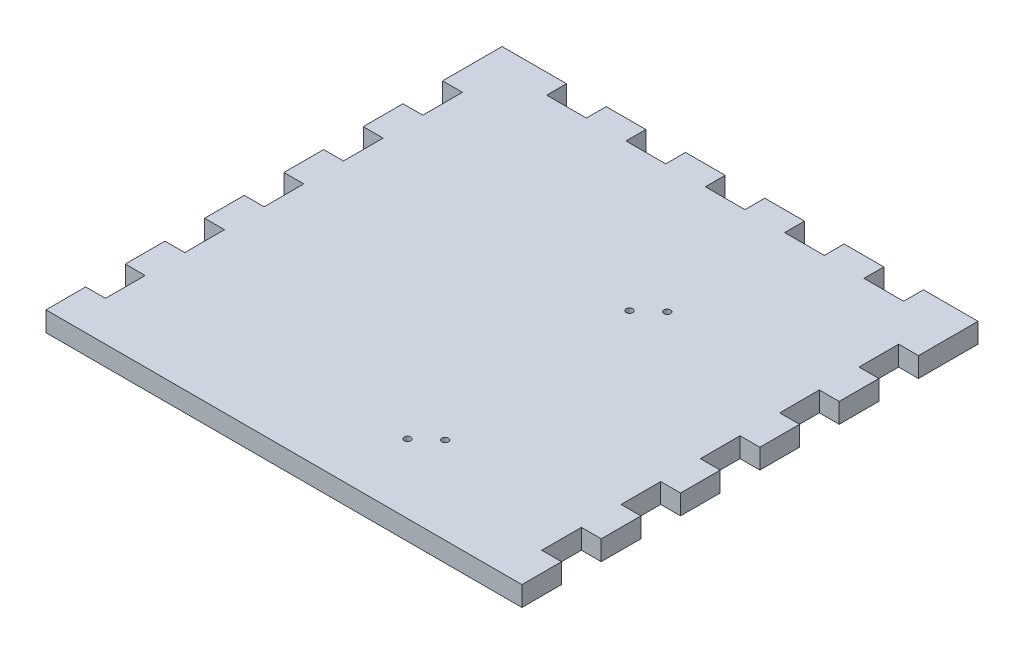
from build123d import *

# Parameters (mm, degrees)
SKETCH1_W               = 279.4
SKETCH1_H               = 279.4
BOSS_EXTRUDE1_DEPTH     = 12.7
SKETCH2_W               = 25.4
SKETCH2_H               = 12.7
BOSS_EXTRUDE2_DEPTH     = 12.7
LPATTERN1_COUNT         = 6
LPATTERN1_PITCH         = 50.8
MIRROR1_COPY_1_SKETCH_W = 25.4
MIRROR1_COPY_1_SKETCH_H = 12.7
MIRROR1_COPY_1_DEPTH    = 12.7
MIRROR1_COPY_2_SKETCH_W = 25.4
MIRROR1_COPY_2_SKETCH_H = 12.7
MIRROR1_COPY_2_DEPTH    = 12.7
MIRROR1_COPY_3_SKETCH_W = 25.4
MIRROR1_COPY_3_SKETCH_H = 12.7
MIRROR1_COPY_3_DEPTH    = 12.7
MIRROR1_COPY_4_SKETCH_W = 25.4
MIRROR1_COPY_4_SKETCH_H = 12.7
MIRROR1_COPY_4_DEPTH    = 12.7
MIRROR1_COPY_5_SKETCH_W = 25.4
MIRROR1_COPY_5_SKETCH_H = 12.7
MIRROR1_COPY_5_DEPTH    = 12.7
MIRROR1_COPY_6_SKETCH_W = 25.4
MIRROR1_COPY_6_SKETCH_H = 12.7
MIRROR1_COPY_6_DEPTH    = 12.7
SKETCH3_W               = 25.4
SKETCH3_H               = 12.7
BOSS_EXTRUDE3_DEPTH     = 12.7
LPATTERN2_COUNT         = 6
LPATTERN2_PITCH         = 50.8
SKETCH5_W               = 25.4
SKETCH5_H               = 12.7
BOSS_EXTRUDE4_DEPTH     = 12.7
SKETCH6_R               = 2.1
SKETCH6_R_2             = 2.133813769
CUT_EXTRUDE1_DEPTH      = 216.9
SKETCH7_R               = 5.08
CUT_EXTRUDE2_DEPTH      = 6.35


with BuildPart() as part:
    # Sketch1 → Boss-Extrude1 (new body)
    with BuildSketch(Plane(origin=(0, 0, 0), x_dir=(1, 0, 0), z_dir=(0, 1, 0))):
        Rectangle(SKETCH1_W, SKETCH1_H)
    extrude(amount=BOSS_EXTRUDE1_DEPTH)

    # Sketch2 → Boss-Extrude2 (add)
    with BuildSketch(Plane(origin=(139.7, 0, 0), x_dir=(0, 0, -1), z_dir=(1, 0, 0))):
        with Locations((-127, 6.35)):
            Rectangle(SKETCH2_W, SKETCH2_H)
    boss_extrude2 = extrude(amount=BOSS_EXTRUDE2_DEPTH)

    # LPattern1: Boss-Extrude2 ×6
    with Locations(*[(0, 0, -i * LPATTERN1_PITCH) for i in range(1, LPATTERN1_COUNT)]):
        add(boss_extrude2)

    # Mirror1 copy 1 sketch → Mirror1 copy 1 (add)
    with BuildSketch(Plane(origin=(-139.7, 0, -50.8), x_dir=(0, 0, -1), z_dir=(-1, 0, 0))):
        with Locations((-127, -6.35)):
            Rectangle(MIRROR1_COPY_1_SKETCH_W, MIRROR1_COPY_1_SKETCH_H)
    extrude(amount=MIRROR1_COPY_1_DEPTH)

    # Mirror1 copy 2 sketch → Mirror1 copy 2 (add)
    with BuildSketch(Plane(origin=(-139.7, 0, -101.6), x_dir=(0, 0, -1), z_dir=(-1, 0, 0))):
        with Locations((-127, -6.35)):
            Rectangle(MIRROR1_COPY_2_SKETCH_W, MIRROR1_COPY_2_SKETCH_H)
    extrude(amount=MIRROR1_COPY_2_DEPTH)

    # Mirror1 copy 3 sketch → Mirror1 copy 3 (add)
    with BuildSketch(Plane(origin=(-139.7, 0, -152.4), x_dir=(0, 0, -1), z_dir=(-1, 0, 0))):
        with Locations((-127, -6.35)):
            Rectangle(MIRROR1_COPY_3_SKETCH_W, MIRROR1_COPY_3_SKETCH_H)
    extrude(amount=MIRROR1_COPY_3_DEPTH)

    # Mirror1 copy 4 sketch → Mirror1 copy 4 (add)
    with BuildSketch(Plane(origin=(-139.7, 0, -203.2), x_dir=(0, 0, -1), z_dir=(-1, 0, 0))):
        with Locations((-127, -6.35)):
            Rectangle(MIRROR1_COPY_4_SKETCH_W, MIRROR1_COPY_4_SKETCH_H)
    extrude(amount=MIRROR1_COPY_4_DEPTH)

    # Mirror1 copy 5 sketch → Mirror1 copy 5 (add)
    with BuildSketch(Plane(origin=(-139.7, 0, -254), x_dir=(0, 0, -1), z_dir=(-1, 0, 0))):
        with Locations((-127, -6.35)):
            Rectangle(MIRROR1_COPY_5_SKETCH_W, MIRROR1_COPY_5_SKETCH_H)
    extrude(amount=MIRROR1_COPY_5_DEPTH)

    # Mirror1 copy 6 sketch → Mirror1 copy 6 (add)
    with BuildSketch(Plane(origin=(-139.7, 0, 0), x_dir=(0, 0, -1), z_dir=(-1, 0, 0))):
        with Locations((-127, -6.35)):
            Rectangle(MIRROR1_COPY_6_SKETCH_W, MIRROR1_COPY_6_SKETCH_H)
    extrude(amount=MIRROR1_COPY_6_DEPTH)

    # Sketch3 → Boss-Extrude3 (add)
    with BuildSketch(Plane(origin=(0, 0, -139.7), x_dir=(-1, 0, 0), z_dir=(0, 0, -1))):
        with Locations((-130.175, 6.35)):
            Rectangle(SKETCH3_W, SKETCH3_H)
    boss_extrude3 = extrude(amount=BOSS_EXTRUDE3_DEPTH)

    # LPattern2: Boss-Extrude3 ×6
    with Locations(*[(-i * LPATTERN2_PITCH, 0, 0) for i in range(1, LPATTERN2_COUNT)]):
        add(boss_extrude3)

    # Sketch5 → Boss-Extrude4 (add)
    with BuildSketch(Plane(origin=(0, 0, -139.7), x_dir=(-1, 0, 0), z_dir=(0, 0, -1))):
        with Locations((-139.7, 6.35)):
            Rectangle(SKETCH5_W, SKETCH5_H)
    boss_extrude4 = extrude(amount=BOSS_EXTRUDE4_DEPTH)

    # Mirror2: Boss-Extrude4 across plane
    add(boss_extrude4.mirror(Plane(origin=(0, 0, 0), x_dir=(0, 0, 1), z_dir=(1, 0, 0))))

    # Sketch6 → Cut-Extrude1 (cut, through all)
    with BuildSketch(Plane(origin=(0, 12.7, 0), x_dir=(1, 0, 0), z_dir=(0, 1, 0))):
        with Locations((34.925, -95.524351229)):
            Circle(SKETCH6_R)
        with Locations((47.625, -84.094351229)):
            Circle(SKETCH6_R)
        with Locations((47.625, 58.145648771)):
            Circle(SKETCH6_R)
        with Locations((34.925, 46.681835003)):
            Circle(SKETCH6_R_2)
    extrude(amount=-CUT_EXTRUDE1_DEPTH, mode=Mode.SUBTRACT)

    # Sketch7 → Cut-Extrude2 (cut)
    with BuildSketch(Plane.XZ):
        with Locations((47.625, -58.145648771)):
            Circle(SKETCH7_R)
        with Locations((34.925, -46.681835003)):
            Circle(SKETCH7_R)
        with Locations((47.625, 84.200184562)):
            Circle(SKETCH7_R)
        with Locations((34.925, 95.524351229)):
            Circle(SKETCH7_R)
    extrude(amount=-CUT_EXTRUDE2_DEPTH, mode=Mode.SUBTRACT)


solid = part.part
